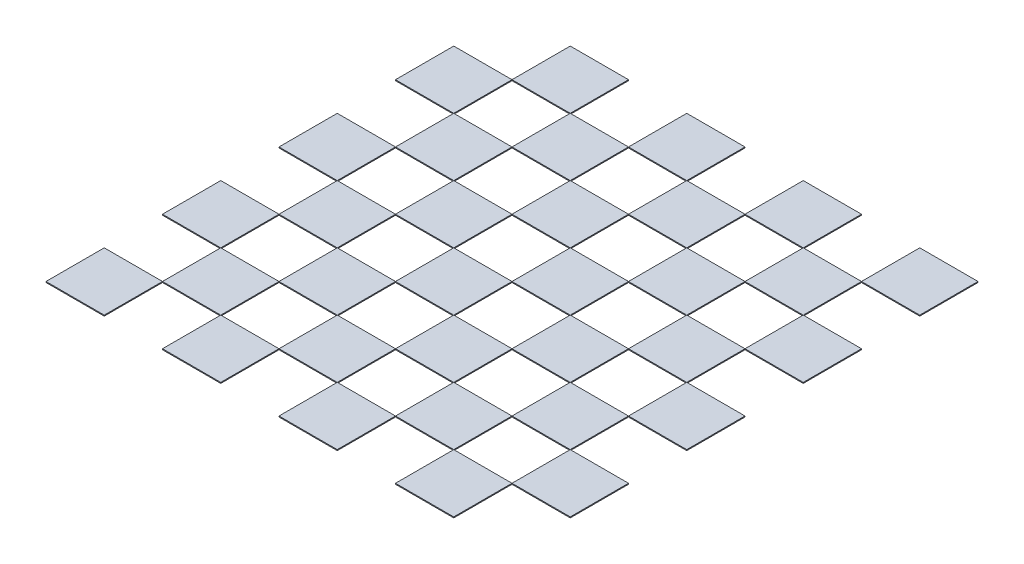
from build123d import *

# Parameters (mm, degrees)
SKETCH1_W              = 25
SKETCH1_H              = 25
WHITE_SQUARES_DEPTH    = 0.4
WHITE_SQUARES_2_DEPTH  = 0.4
WHITE_SQUARES_3_DEPTH  = 0.4
WHITE_SQUARES_4_DEPTH  = 0.4
WHITE_SQUARES_5_DEPTH  = 0.4
WHITE_SQUARES_6_DEPTH  = 0.4
WHITE_SQUARES_7_DEPTH  = 0.4
WHITE_SQUARES_8_DEPTH  = 0.4
WHITE_SQUARES_9_DEPTH  = 0.4
WHITE_SQUARES_10_DEPTH = 0.4
WHITE_SQUARES_11_DEPTH = 0.4
WHITE_SQUARES_12_DEPTH = 0.4
WHITE_SQUARES_13_DEPTH = 0.4
WHITE_SQUARES_14_DEPTH = 0.4
WHITE_SQUARES_15_DEPTH = 0.4
WHITE_SQUARES_16_DEPTH = 0.4
WHITE_SQUARES_17_DEPTH = 0.4
WHITE_SQUARES_18_DEPTH = 0.4
WHITE_SQUARES_19_DEPTH = 0.4
WHITE_SQUARES_20_DEPTH = 0.4
WHITE_SQUARES_21_DEPTH = 0.4
WHITE_SQUARES_22_DEPTH = 0.4
WHITE_SQUARES_23_DEPTH = 0.4
WHITE_SQUARES_24_DEPTH = 0.4
WHITE_SQUARES_25_DEPTH = 0.4
WHITE_SQUARES_26_DEPTH = 0.4
WHITE_SQUARES_27_DEPTH = 0.4
WHITE_SQUARES_28_DEPTH = 0.4
WHITE_SQUARES_29_DEPTH = 0.4
WHITE_SQUARES_30_DEPTH = 0.4
WHITE_SQUARES_31_DEPTH = 0.4
WHITE_SQUARES_32_DEPTH = 0.4


with BuildPart() as part:
    # Sketch1 → White Squares (new body)
    with BuildSketch(Plane(origin=(0, 0, 0), x_dir=(1, 0, 0), z_dir=(0, 1, 0))):
        with Locations((-62.5, 87.5)):
            Rectangle(SKETCH1_W, SKETCH1_H)
    extrude(amount=WHITE_SQUARES_DEPTH)


with BuildPart() as body_2:
    # Sketch1 → White Squares 2 (new body)
    with BuildSketch(Plane(origin=(0, 0, 0), x_dir=(1, 0, 0), z_dir=(0, 1, 0))):
        with Locations((-87.5, 62.5)):
            Rectangle(SKETCH1_W, SKETCH1_H)
    extrude(amount=WHITE_SQUARES_2_DEPTH)


with BuildPart() as body_3:
    # Sketch1 → White Squares 3 (new body)
    with BuildSketch(Plane(origin=(0, 0, 0), x_dir=(1, 0, 0), z_dir=(0, 1, 0))):
        with Locations((-37.5, 62.5)):
            Rectangle(SKETCH1_W, SKETCH1_H)
    extrude(amount=WHITE_SQUARES_3_DEPTH)


with BuildPart() as body_4:
    # Sketch1 → White Squares 4 (new body)
    with BuildSketch(Plane(origin=(0, 0, 0), x_dir=(1, 0, 0), z_dir=(0, 1, 0))):
        with Locations((-62.5, 37.5)):
            Rectangle(SKETCH1_W, SKETCH1_H)
    extrude(amount=WHITE_SQUARES_4_DEPTH)


with BuildPart() as body_5:
    # Sketch1 → White Squares 5 (new body)
    with BuildSketch(Plane(origin=(0, 0, 0), x_dir=(1, 0, 0), z_dir=(0, 1, 0))):
        with Locations((-12.5, 87.5)):
            Rectangle(SKETCH1_W, SKETCH1_H)
    extrude(amount=WHITE_SQUARES_5_DEPTH)


with BuildPart() as body_6:
    # Sketch1 → White Squares 6 (new body)
    with BuildSketch(Plane(origin=(0, 0, 0), x_dir=(1, 0, 0), z_dir=(0, 1, 0))):
        with Locations((-87.5, 12.5)):
            Rectangle(SKETCH1_W, SKETCH1_H)
    extrude(amount=WHITE_SQUARES_6_DEPTH)


with BuildPart() as body_7:
    # Sketch1 → White Squares 7 (new body)
    with BuildSketch(Plane(origin=(0, 0, 0), x_dir=(1, 0, 0), z_dir=(0, 1, 0))):
        with Locations((12.5, 62.5)):
            Rectangle(SKETCH1_W, SKETCH1_H)
    extrude(amount=WHITE_SQUARES_7_DEPTH)


with BuildPart() as body_8:
    # Sketch1 → White Squares 8 (new body)
    with BuildSketch(Plane(origin=(0, 0, 0), x_dir=(1, 0, 0), z_dir=(0, 1, 0))):
        with Locations((-12.5, 37.5)):
            Rectangle(SKETCH1_W, SKETCH1_H)
    extrude(amount=WHITE_SQUARES_8_DEPTH)


with BuildPart() as body_9:
    # Sketch1 → White Squares 9 (new body)
    with BuildSketch(Plane(origin=(0, 0, 0), x_dir=(1, 0, 0), z_dir=(0, 1, 0))):
        with Locations((-37.5, 12.5)):
            Rectangle(SKETCH1_W, SKETCH1_H)
    extrude(amount=WHITE_SQUARES_9_DEPTH)


with BuildPart() as body_10:
    # Sketch1 → White Squares 10 (new body)
    with BuildSketch(Plane(origin=(0, 0, 0), x_dir=(1, 0, 0), z_dir=(0, 1, 0))):
        with Locations((-62.5, -12.5)):
            Rectangle(SKETCH1_W, SKETCH1_H)
    extrude(amount=WHITE_SQUARES_10_DEPTH)


with BuildPart() as body_11:
    # Sketch1 → White Squares 11 (new body)
    with BuildSketch(Plane(origin=(0, 0, 0), x_dir=(1, 0, 0), z_dir=(0, 1, 0))):
        with Locations((37.5, 87.5)):
            Rectangle(SKETCH1_W, SKETCH1_H)
    extrude(amount=WHITE_SQUARES_11_DEPTH)


with BuildPart() as body_12:
    # Sketch1 → White Squares 12 (new body)
    with BuildSketch(Plane(origin=(0, 0, 0), x_dir=(1, 0, 0), z_dir=(0, 1, 0))):
        with Locations((-87.5, -37.5)):
            Rectangle(SKETCH1_W, SKETCH1_H)
    extrude(amount=WHITE_SQUARES_12_DEPTH)


with BuildPart() as body_13:
    # Sketch1 → White Squares 13 (new body)
    with BuildSketch(Plane(origin=(0, 0, 0), x_dir=(1, 0, 0), z_dir=(0, 1, 0))):
        with Locations((62.5, 62.5)):
            Rectangle(SKETCH1_W, SKETCH1_H)
    extrude(amount=WHITE_SQUARES_13_DEPTH)


with BuildPart() as body_14:
    # Sketch1 → White Squares 14 (new body)
    with BuildSketch(Plane(origin=(0, 0, 0), x_dir=(1, 0, 0), z_dir=(0, 1, 0))):
        with Locations((37.5, 37.5)):
            Rectangle(SKETCH1_W, SKETCH1_H)
    extrude(amount=WHITE_SQUARES_14_DEPTH)


with BuildPart() as body_15:
    # Sketch1 → White Squares 15 (new body)
    with BuildSketch(Plane(origin=(0, 0, 0), x_dir=(1, 0, 0), z_dir=(0, 1, 0))):
        with Locations((12.5, 12.5)):
            Rectangle(SKETCH1_W, SKETCH1_H)
    extrude(amount=WHITE_SQUARES_15_DEPTH)


with BuildPart() as body_16:
    # Sketch1 → White Squares 16 (new body)
    with BuildSketch(Plane(origin=(0, 0, 0), x_dir=(1, 0, 0), z_dir=(0, 1, 0))):
        with Locations((-12.5, -12.5)):
            Rectangle(SKETCH1_W, SKETCH1_H)
    extrude(amount=WHITE_SQUARES_16_DEPTH)


with BuildPart() as body_17:
    # Sketch1 → White Squares 17 (new body)
    with BuildSketch(Plane(origin=(0, 0, 0), x_dir=(1, 0, 0), z_dir=(0, 1, 0))):
        with Locations((-37.5, -37.5)):
            Rectangle(SKETCH1_W, SKETCH1_H)
    extrude(amount=WHITE_SQUARES_17_DEPTH)


with BuildPart() as body_18:
    # Sketch1 → White Squares 18 (new body)
    with BuildSketch(Plane(origin=(0, 0, 0), x_dir=(1, 0, 0), z_dir=(0, 1, 0))):
        with Locations((-62.5, -62.5)):
            Rectangle(SKETCH1_W, SKETCH1_H)
    extrude(amount=WHITE_SQUARES_18_DEPTH)


with BuildPart() as body_19:
    # Sketch1 → White Squares 19 (new body)
    with BuildSketch(Plane(origin=(0, 0, 0), x_dir=(1, 0, 0), z_dir=(0, 1, 0))):
        with Locations((87.5, 87.5)):
            Rectangle(SKETCH1_W, SKETCH1_H)
    extrude(amount=WHITE_SQUARES_19_DEPTH)


with BuildPart() as body_20:
    # Sketch1 → White Squares 20 (new body)
    with BuildSketch(Plane(origin=(0, 0, 0), x_dir=(1, 0, 0), z_dir=(0, 1, 0))):
        with Locations((-87.5, -87.5)):
            Rectangle(SKETCH1_W, SKETCH1_H)
    extrude(amount=WHITE_SQUARES_20_DEPTH)


with BuildPart() as body_21:
    # Sketch1 → White Squares 21 (new body)
    with BuildSketch(Plane(origin=(0, 0, 0), x_dir=(1, 0, 0), z_dir=(0, 1, 0))):
        with Locations((87.5, 37.5)):
            Rectangle(SKETCH1_W, SKETCH1_H)
    extrude(amount=WHITE_SQUARES_21_DEPTH)


with BuildPart() as body_22:
    # Sketch1 → White Squares 22 (new body)
    with BuildSketch(Plane(origin=(0, 0, 0), x_dir=(1, 0, 0), z_dir=(0, 1, 0))):
        with Locations((62.5, 12.5)):
            Rectangle(SKETCH1_W, SKETCH1_H)
    extrude(amount=WHITE_SQUARES_22_DEPTH)


with BuildPart() as body_23:
    # Sketch1 → White Squares 23 (new body)
    with BuildSketch(Plane(origin=(0, 0, 0), x_dir=(1, 0, 0), z_dir=(0, 1, 0))):
        with Locations((37.5, -12.5)):
            Rectangle(SKETCH1_W, SKETCH1_H)
    extrude(amount=WHITE_SQUARES_23_DEPTH)


with BuildPart() as body_24:
    # Sketch1 → White Squares 24 (new body)
    with BuildSketch(Plane(origin=(0, 0, 0), x_dir=(1, 0, 0), z_dir=(0, 1, 0))):
        with Locations((12.5, -37.5)):
            Rectangle(SKETCH1_W, SKETCH1_H)
    extrude(amount=WHITE_SQUARES_24_DEPTH)


with BuildPart() as body_25:
    # Sketch1 → White Squares 25 (new body)
    with BuildSketch(Plane(origin=(0, 0, 0), x_dir=(1, 0, 0), z_dir=(0, 1, 0))):
        with Locations((-12.5, -62.5)):
            Rectangle(SKETCH1_W, SKETCH1_H)
    extrude(amount=WHITE_SQUARES_25_DEPTH)


with BuildPart() as body_26:
    # Sketch1 → White Squares 26 (new body)
    with BuildSketch(Plane(origin=(0, 0, 0), x_dir=(1, 0, 0), z_dir=(0, 1, 0))):
        with Locations((-37.5, -87.5)):
            Rectangle(SKETCH1_W, SKETCH1_H)
    extrude(amount=WHITE_SQUARES_26_DEPTH)


with BuildPart() as body_27:
    # Sketch1 → White Squares 27 (new body)
    with BuildSketch(Plane(origin=(0, 0, 0), x_dir=(1, 0, 0), z_dir=(0, 1, 0))):
        with Locations((87.5, -12.5)):
            Rectangle(SKETCH1_W, SKETCH1_H)
    extrude(amount=WHITE_SQUARES_27_DEPTH)


with BuildPart() as body_28:
    # Sketch1 → White Squares 28 (new body)
    with BuildSketch(Plane(origin=(0, 0, 0), x_dir=(1, 0, 0), z_dir=(0, 1, 0))):
        with Locations((62.5, -37.5)):
            Rectangle(SKETCH1_W, SKETCH1_H)
    extrude(amount=WHITE_SQUARES_28_DEPTH)


with BuildPart() as body_29:
    # Sketch1 → White Squares 29 (new body)
    with BuildSketch(Plane(origin=(0, 0, 0), x_dir=(1, 0, 0), z_dir=(0, 1, 0))):
        with Locations((37.5, -62.5)):
            Rectangle(SKETCH1_W, SKETCH1_H)
    extrude(amount=WHITE_SQUARES_29_DEPTH)


with BuildPart() as body_30:
    # Sketch1 → White Squares 30 (new body)
    with BuildSketch(Plane(origin=(0, 0, 0), x_dir=(1, 0, 0), z_dir=(0, 1, 0))):
        with Locations((12.5, -87.5)):
            Rectangle(SKETCH1_W, SKETCH1_H)
    extrude(amount=WHITE_SQUARES_30_DEPTH)


with BuildPart() as body_31:
    # Sketch1 → White Squares 31 (new body)
    with BuildSketch(Plane(origin=(0, 0, 0), x_dir=(1, 0, 0), z_dir=(0, 1, 0))):
        with Locations((87.5, -62.5)):
            Rectangle(SKETCH1_W, SKETCH1_H)
    extrude(amount=WHITE_SQUARES_31_DEPTH)


with BuildPart() as body_32:
    # Sketch1 → White Squares 32 (new body)
    with BuildSketch(Plane(origin=(0, 0, 0), x_dir=(1, 0, 0), z_dir=(0, 1, 0))):
        with Locations((62.5, -87.5)):
            Rectangle(SKETCH1_W, SKETCH1_H)
    extrude(amount=WHITE_SQUARES_32_DEPTH)


solid = Compound([part.part, body_2.part, body_3.part, body_4.part, body_5.part, body_6.part, body_7.part, body_8.part, body_9.part, body_10.part, body_11.part, body_12.part, body_13.part, body_14.part, body_15.part, body_16.part, body_17.part, body_18.part, body_19.part, body_20.part, body_21.part, body_22.part, body_23.part, body_24.part, body_25.part, body_26.part, body_27.part, body_28.part, body_29.part, body_30.part, body_31.part, body_32.part])
